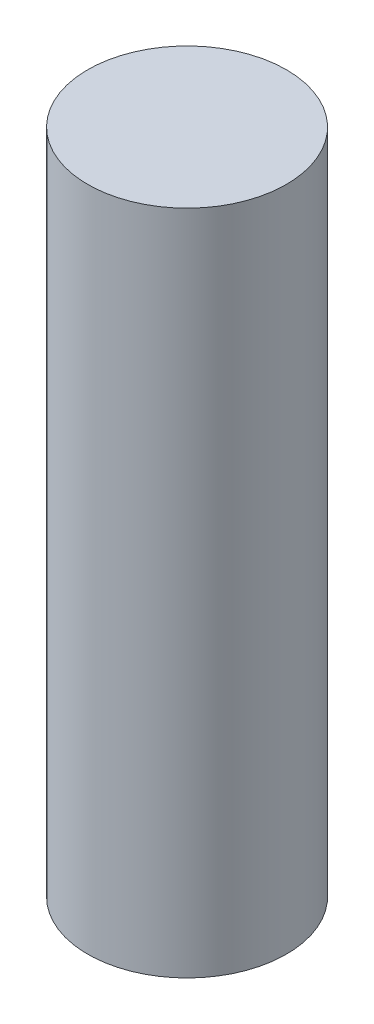
from build123d import *

# Parameters (mm, degrees)
SKETCH1_R           = 3.937
BOSS_EXTRUDE1_DEPTH = 26.416


with BuildPart() as part:
    # Sketch1 → Boss-Extrude1 (new body)
    with BuildSketch(Plane(origin=(0, 0, 0), x_dir=(1, 0, 0), z_dir=(0, 1, 0))):
        Circle(SKETCH1_R)
    extrude(amount=BOSS_EXTRUDE1_DEPTH)


solid = part.part
